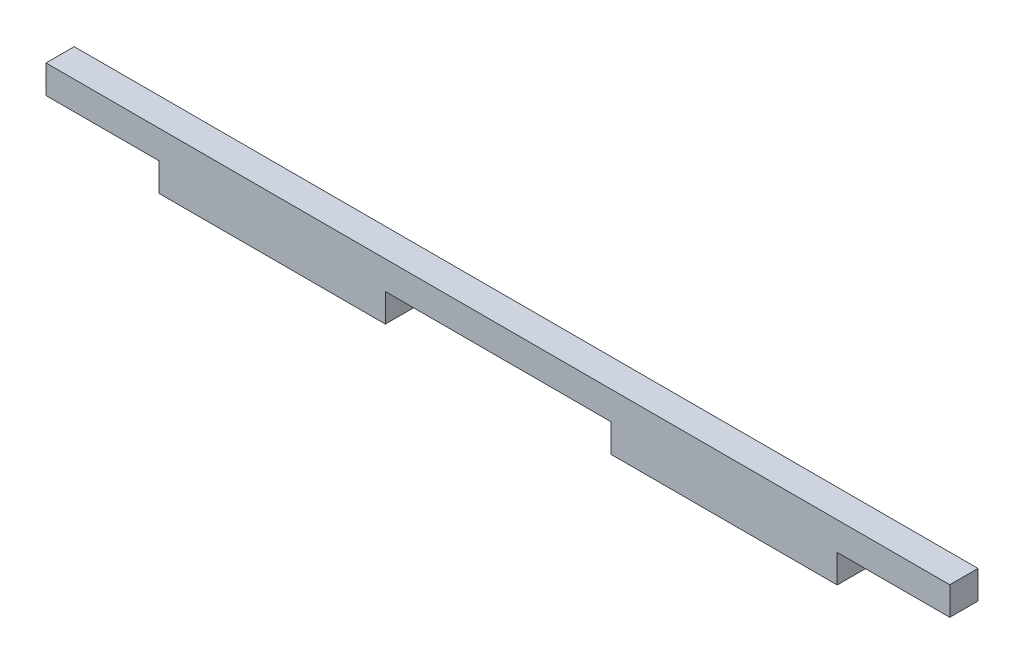
from build123d import *

# Parameters (mm, degrees)
BOSS_EXTRUDE1_DEPTH = 1.5875


with BuildPart() as part:
    # Sketch1 → Boss-Extrude1 (new, symmetric)
    with BuildSketch(Plane.XY):
        Polygon((-12.6492, -1.5875), (12.7, -1.5875), (12.7, -4.7625), (38.1508, -4.7625), (38.1508, -1.5875), (50.8, -1.5875), (50.8, 1.5875), (-50.8, 1.5875), (-50.8, -1.5875), (-38.1, -1.5875), (-38.1, -4.7625), (-12.6492, -4.7625), align=None)
    extrude(amount=BOSS_EXTRUDE1_DEPTH, both=True)


solid = part.part
